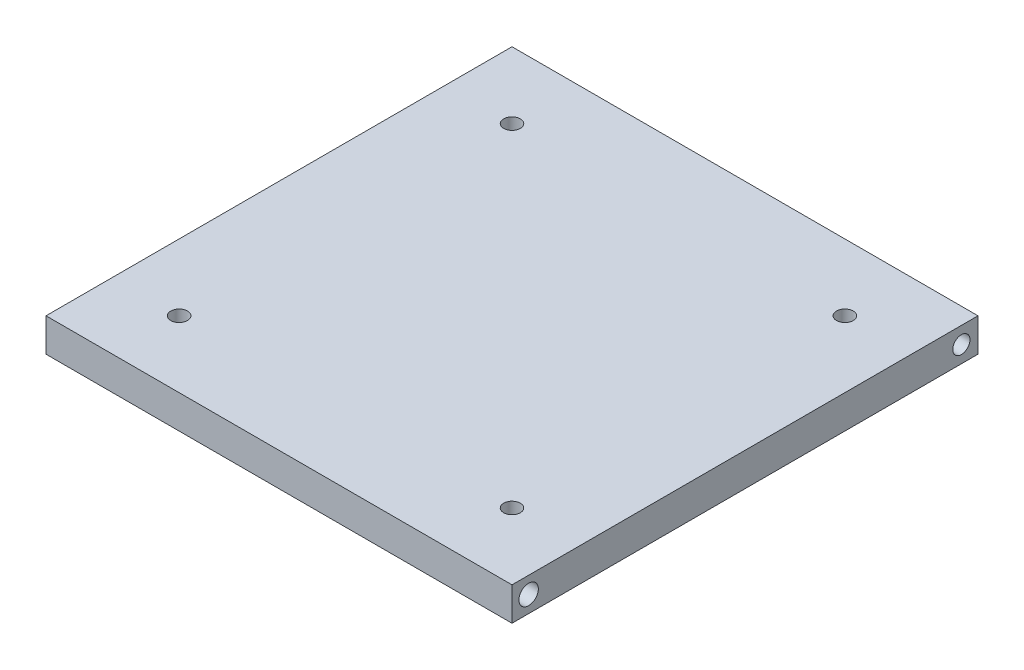
from build123d import *

# Parameters (mm, degrees)
SKETCH1_W            = 84
SKETCH1_H            = 84
BOSS_EXTRUDE1_DEPTH  = 6
SKETCH2_R            = 1.5
CUT_EXTRUDE1_DEPTH   = 6
LPATTERN1_COUNT      = 2
LPATTERN1_PITCH      = 60
LPATTERN1_COUNT_DIR2 = 2
LPATTERN1_PITCH_DIR2 = 60
SKETCH3_R            = 1.549904247
SKETCH3_R_2          = 1.748244363
CUT_EXTRUDE2_DEPTH   = 10


with BuildPart() as part:
    # Sketch1 → Boss-Extrude1 (new body)
    with BuildSketch(Plane(origin=(0, 0, 0), x_dir=(1, 0, 0), z_dir=(0, 1, 0))):
        with Locations((42, 42)):
            Rectangle(SKETCH1_W, SKETCH1_H)
    extrude(amount=BOSS_EXTRUDE1_DEPTH)

    # Sketch2 → Cut-Extrude1 (cut)
    with BuildSketch(Plane(origin=(0, 6, 0), x_dir=(1, 0, 0), z_dir=(0, 1, 0))):
        with Locations((12, 72)):
            Circle(SKETCH2_R)
    cut_extrude1 = extrude(amount=-CUT_EXTRUDE1_DEPTH, mode=Mode.SUBTRACT)

    # LPattern1: Cut-Extrude1 2 × 2
    with Locations(*[(i * LPATTERN1_PITCH, 0, j * LPATTERN1_PITCH_DIR2) for i in range(LPATTERN1_COUNT) for j in range(LPATTERN1_COUNT_DIR2) if (i, j) != (0, 0)]):
        add(cut_extrude1, mode=Mode.SUBTRACT)

    # Sketch3 → Cut-Extrude2 (cut)
    with BuildSketch(Plane.ZY):
        with Locations((-81, 3)):
            Circle(SKETCH3_R)
        with Locations((-3, 3)):
            Circle(SKETCH3_R_2)
    cut_extrude2 = extrude(amount=-CUT_EXTRUDE2_DEPTH, mode=Mode.SUBTRACT)

    # Mirror1: Cut-Extrude2 across plane
    add(cut_extrude2.mirror(Plane.ZY.offset(-42)), mode=Mode.SUBTRACT)


solid = part.part
